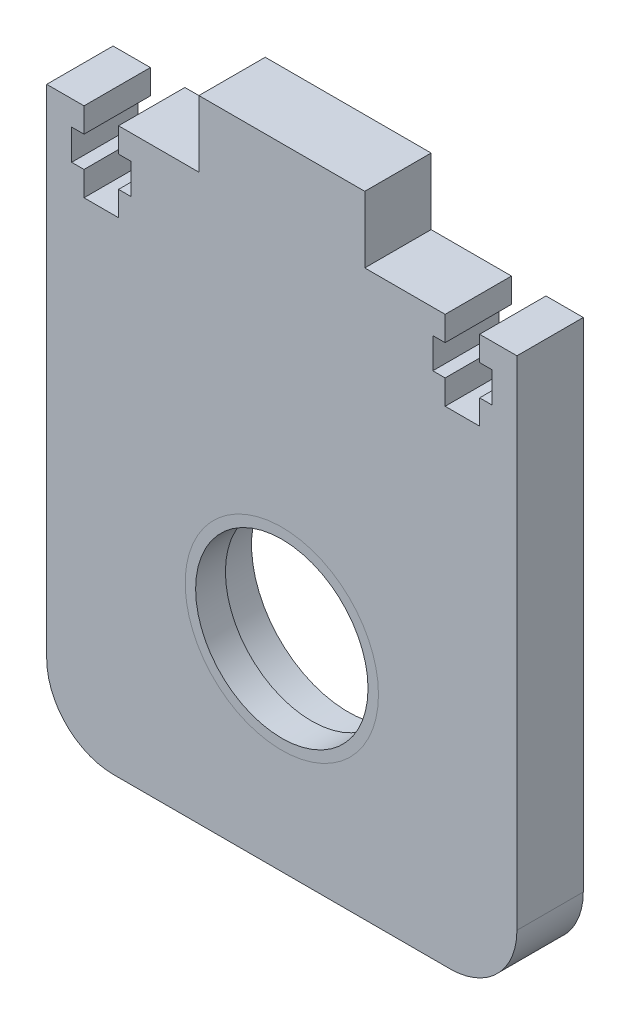
from build123d import *

# Parameters (mm, degrees)
SKETCH12_W           = 90
SKETCH12_H           = 108.03
BOSS_EXTRUDE10_DEPTH = 12.7
SKETCH25_R           = 18.5
CUT_EXTRUDE1_DEPTH   = 188.013488671
SKETCH26_R           = 18.5
SKETCH26_R_2         = 16.5
BOSS_EXTRUDE15_DEPTH = 5.7
FILLET1_R            = 12.8
CUT_EXTRUDE2_DEPTH   = 188.013488671
BOSS_EXTRUDE16_DEPTH = 12.7


with BuildPart() as part:
    # Sketch12 → Boss-Extrude10 (new body)
    with BuildSketch(Plane.XY):
        with Locations((107.125849364, 54.015)):
            Rectangle(SKETCH12_W, SKETCH12_H)
    extrude(amount=BOSS_EXTRUDE10_DEPTH)

    # Sketch25 → Cut-Extrude1 (cut, through all)
    with BuildSketch(Plane.XY.offset(12.7)):
        with Locations((107.125849364, 38.627603634)):
            Circle(SKETCH25_R)
    extrude(amount=-CUT_EXTRUDE1_DEPTH, mode=Mode.SUBTRACT)

    # Fillet1
    fillet1_edges = [part.edges().sort_by_distance(p)[0] for p in [
        (152.125849364, 0, 6.35),
        (62.125849364, 0, 6.35),
    ]]
    fillet(fillet1_edges, radius=FILLET1_R)

    # Sketch27 → Cut-Extrude2 (cut, through all)
    with BuildSketch(Plane(origin=(0, 0, 0), x_dir=(-1, 0, 0), z_dir=(0, 0, -1))):
        Polygon((-138.383849364, 103.331), (-138.383849364, 108.03), (-144.987849364, 108.03), (-144.987849364, 103.331), (-147.349849364, 103.331), (-147.349849364, 97.489), (-144.987849364, 97.489), (-144.987849364, 92.79), (-138.383849364, 92.79), (-138.383849364, 97.489), (-136.021849364, 97.489), (-136.021849364, 103.331), align=None)
        Polygon((-69.263849364, 103.331), (-69.263849364, 108.03), (-75.867849364, 108.03), (-75.867849364, 103.331), (-78.229849364, 103.331), (-78.229849364, 97.489), (-75.867849364, 97.489), (-75.867849364, 92.79), (-69.263849364, 92.79), (-69.263849364, 97.489), (-66.901849364, 97.489), (-66.901849364, 103.331), align=None)
    extrude(amount=-CUT_EXTRUDE2_DEPTH, mode=Mode.SUBTRACT)

    # Sketch28 → Boss-Extrude16 (add)
    with BuildSketch(Plane(origin=(0, 108.03, 0), x_dir=(1, 0, 0), z_dir=(0, 1, 0))):
        Polygon((107.125849364, 0), (91.250849364, 0), (91.250849364, -12.7), (123.000849364, -12.7), (123.000849364, 0), align=None)
    extrude(amount=BOSS_EXTRUDE16_DEPTH)


with BuildPart() as body_2:
    # Sketch26 → Boss-Extrude15 (new body)
    with BuildSketch(Plane.XY.offset(12.7)):
        with Locations((107.125849364, 38.627603634)):
            Circle(SKETCH26_R)
        with Locations((107.125849364, 38.627603634)):
            Circle(SKETCH26_R_2, mode=Mode.SUBTRACT)
    extrude(amount=-BOSS_EXTRUDE15_DEPTH)


solid = Compound([part.part, body_2.part])
